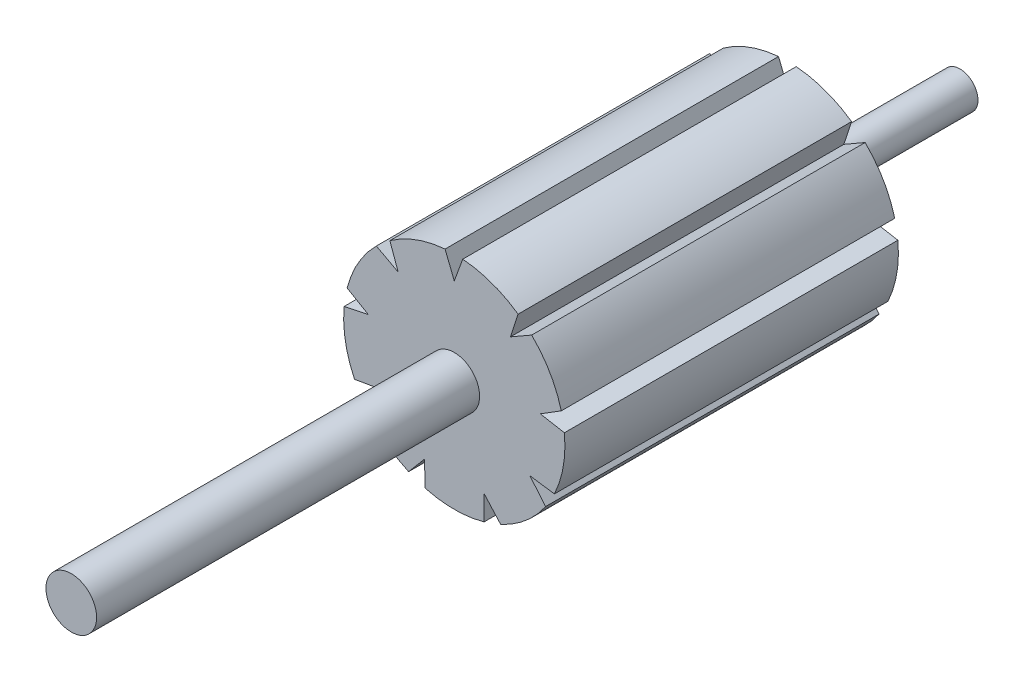
from build123d import *

# Parameters (mm, degrees)
BOSS_EXTRUDE1_DEPTH = 18.44
SKETCH7_R           = 1
BOSS_EXTRUDE4_DEPTH = 9.52
SKETCH2_R           = 1.400281721
BOSS_EXTRUDE5_DEPTH = 21.18


with BuildPart() as part:
    # Sketch1 → Boss-Extrude1 (new body)
    with BuildSketch(Plane.XY):
        with BuildLine():
            Line((3.102637299, 3.697579148), (4.279619218, 4.373206779))
            ThreePointArc((4.279619218, 4.373206779), (5.288327072, 3.077933555), (5.916340543, 1.561087044))
            Line((5.916340543, 1.561087044), (4.753516124, 0.838173146))
            Line((4.753516124, 0.838173146), (6.089421653, 0.599184544))
            ThreePointArc((6.089421653, 0.599184544), (6.029551119, -1.041437222), (5.535627206, -2.607088341))
            Line((5.535627206, -2.607088341), (4.180171925, -2.413423386))
            Line((4.180171925, -2.413423386), (5.04991602, -3.455202798))
            ThreePointArc((5.04991602, -3.455202798), (3.949481187, -4.673507948), (2.564732378, -5.555378116))
            Line((2.564732378, -5.555378116), (1.650878825, -4.535752294))
            Line((1.650878825, -4.535752294), (1.647498557, -5.892862351))
            ThreePointArc((1.647498557, -5.892862351), (0.021405114, -6.118792365), (-1.606229234, -5.90424473))
            Line((-1.606229234, -5.90424473), (-1.650878825, -4.535752294))
            Line((-1.650878825, -4.535752294), (-2.52580179, -5.573186118))
            ThreePointArc((-2.52580179, -5.573186118), (-3.91668665, -4.701025832), (-5.025618336, -3.490449616))
            Line((-5.025618336, -3.490449616), (-4.180171925, -2.413423386))
            Line((-4.180171925, -2.413423386), (-5.517251408, -2.645754161))
            ThreePointArc((-5.517251408, -2.645754161), (-6.022117201, -1.083597066), (-6.093464765, 0.556565665))
            Line((-6.093464765, 0.556565665), (-4.753516124, 0.838173146))
            Line((-4.753516124, 0.838173146), (-5.927117776, 1.519655572))
            ThreePointArc((-5.927117776, 1.519655572), (-5.309732185, 3.04085881), (-4.310111309, 4.343157686))
            Line((-4.310111309, 4.343157686), (-3.102637299, 3.697579148))
            Line((-3.102637299, 3.697579148), (-3.563619863, 4.974001574))
            ThreePointArc((-3.563619863, 4.974001574), (-2.112864469, 5.742463053), (-0.51000887, 6.097537957))
            Line((-0.51000887, 6.097537957), (0, 4.826846773))
            Line((0, 4.826846773), (0.467335389, 6.100956959))
            ThreePointArc((0.467335389, 6.100956959), (2.072636014, 5.757105014), (3.528732387, 4.998812451))
            Line((3.528732387, 4.998812451), (3.102637299, 3.697579148))
        make_face()
    extrude(amount=BOSS_EXTRUDE1_DEPTH)

    # Sketch7 → Boss-Extrude4 (add)
    with BuildSketch(Plane(origin=(0, 0, 0), x_dir=(-1, 0, 0), z_dir=(0, 0, -1))):
        Circle(SKETCH7_R)
    extrude(amount=BOSS_EXTRUDE4_DEPTH)

    # Sketch2 → Boss-Extrude5 (add)
    with BuildSketch(Plane.XY.offset(18.44)):
        Circle(SKETCH2_R)
    extrude(amount=BOSS_EXTRUDE5_DEPTH)


solid = part.part
